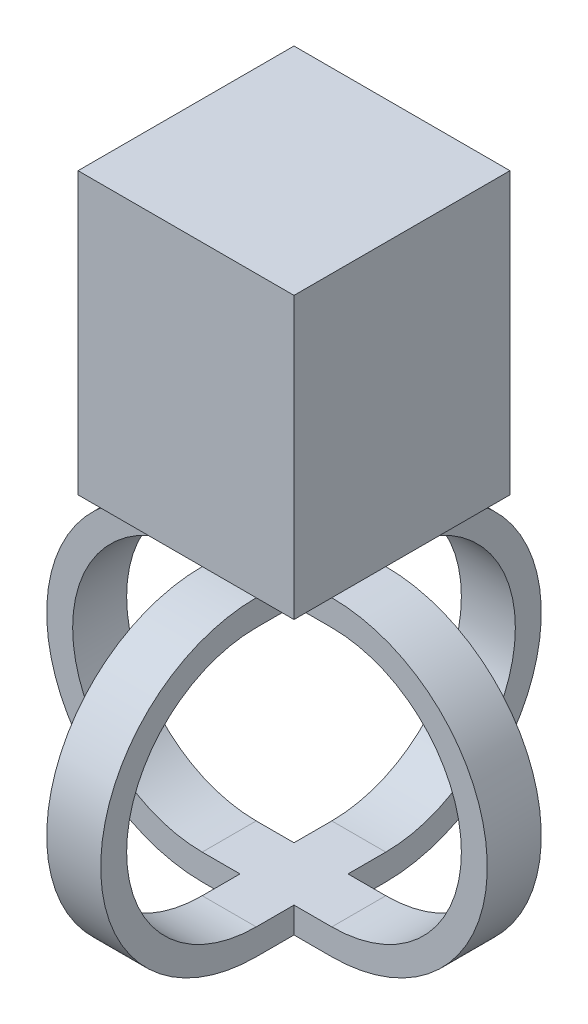
from build123d import *

# Parameters (mm, degrees)
BOSS_EXTRUDE1_DEPTH = 1.25
CIRPATTERN1_COUNT   = 4
SKETCH2_W           = 10
SKETCH2_H           = 10
BOSS_EXTRUDE2_DEPTH = 15
CHAMFER1_SIZE       = 2


with BuildPart() as part:
    # Sketch1 → Boss-Extrude1 (new, symmetric)
    with BuildSketch(Plane.XY):
        with BuildLine():
            Line((0, 0), (3, 0))
            ThreePointArc((3, 0), (10.2, 7.2), (3, 14.4))
            Line((3, 14.4), (0, 14.4))
            Line((0, 14.4), (0, 13.2))
            Line((0, 13.2), (3, 13.2))
            ThreePointArc((3, 13.2), (9, 7.2), (3, 1.2))
            Line((3, 1.2), (0, 1.2))
            Line((0, 1.2), (0, 0))
        make_face()
    boss_extrude1 = extrude(amount=BOSS_EXTRUDE1_DEPTH, both=True)

    # CirPattern1: Boss-Extrude1 ×4 about axis
    cirpattern1_axis = Axis((0, 0.181805076, 0), (0, 1, 0))
    for i in range(1, CIRPATTERN1_COUNT):
        add(boss_extrude1.rotate(cirpattern1_axis, i * 360 / CIRPATTERN1_COUNT))


with BuildPart() as body_2:
    # Sketch2 → Boss-Extrude2 (new body)
    with BuildSketch(Plane(origin=(0, 14.4, 0), x_dir=(1, 0, 0), z_dir=(0, 1, 0))):
        Rectangle(SKETCH2_W, SKETCH2_H)
    extrude(amount=BOSS_EXTRUDE2_DEPTH)

    # Chamfer1
    chamfer1_edges = [body_2.edges().sort_by_distance(p)[0] for p in [
        (0, 14.4, -5),
        (5, 14.4, 0),
        (0, 14.4, 5),
        (-5, 14.4, 0),
    ]]
    chamfer(chamfer1_edges, length=CHAMFER1_SIZE)


solid = Compound([part.part, body_2.part])
